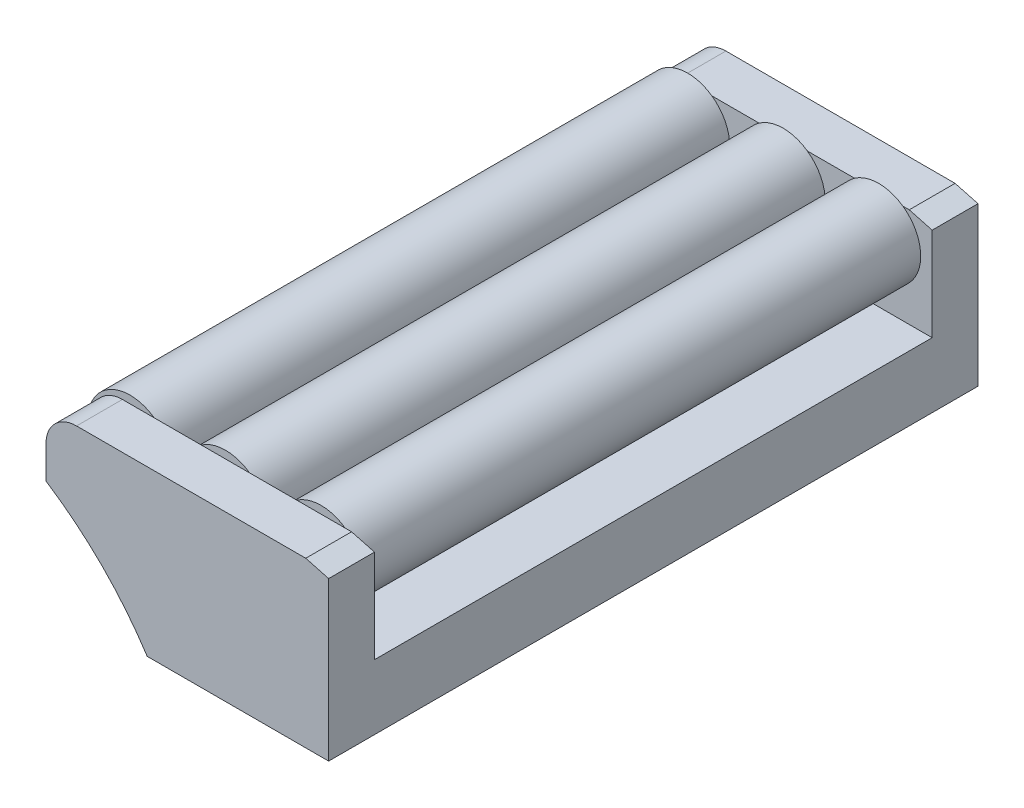
from build123d import *
from OCP.BRepFilletAPI import BRepFilletAPI_MakeChamfer

# Parameters (mm, degrees)
SCHIZZO1_W               = 37
SCHIZZO1_H               = 21.5
ESTRUSIONE1_DEPTH        = 85
SCHIZZO6_W               = 73
SCHIZZO6_H               = 23.639461627
TAGLIO_ESTRUSIONE4_DEPTH = 84
SCHIZZO7_R               = 5.5
ESTRUSIONE4_DEPTH        = 73
SMUSSO1_SIZE             = 3
SMUSSO1_SIZE2            = 0.803847577
RACCORDO1_R              = 4
SCHIZZO8_R               = 45
TAGLIO_ESTRUSIONE5_DEPTH = 96.395230489
SCHIZZO9_R               = 3
TAGLIO_ESTRUSIONE6_DEPTH = 8.5


with BuildPart() as part:
    # Schizzo1 → Estrusione1 (new body)
    with BuildSketch(Plane.XY):
        with Locations((18.5, 10.75)):
            Rectangle(SCHIZZO1_W, SCHIZZO1_H)
    extrude(amount=ESTRUSIONE1_DEPTH)

    # Schizzo6 → Taglio-Estrusione4 (cut)
    with BuildSketch(Plane(origin=(37, 0, 0), x_dir=(0, 0, -1), z_dir=(1, 0, 0))):
        with Locations((-42.5, 20.319730814)):
            Rectangle(SCHIZZO6_W, SCHIZZO6_H)
    extrude(amount=-TAGLIO_ESTRUSIONE4_DEPTH, mode=Mode.SUBTRACT)

    # Schizzo7 → Estrusione4 (add)
    with BuildSketch(Plane.XY.offset(6)):
        with Locations(Location((5, 17, 0), (0, 0, 155.380022671))):
            Circle(SCHIZZO7_R)
        with Locations(Location((17.5, 17, 0), (0, 0, 125.096801228))):
            Circle(SCHIZZO7_R)
        with Locations(Location((30, 17, 0), (0, 0, 125.096801228))):
            Circle(SCHIZZO7_R)
    extrude(amount=ESTRUSIONE4_DEPTH)

    # Smusso1: one chamfer whose edges measure the first distance from different faces: ONE call of the kernel's chamfer builder (chamfer() names one face for all edges)
    smusso1_edges_1 = [part.edges().sort_by_distance(p)[0] for p in [
        (37, 21.5, 3),
    ]]
    smusso1_side_1 = [part.faces().sort_by_distance(p)[0] for p in [
        (18.5, 21.5, 3),
    ]]
    smusso1_edges_2 = [part.edges().sort_by_distance(p)[0] for p in [
        (37, 21.5, 82),
    ]]
    smusso1_side_2 = [part.faces().sort_by_distance(p)[0] for p in [
        (18.5, 21.5, 82),
    ]]
    smusso1 = BRepFilletAPI_MakeChamfer(part.part.solid().wrapped)
    for e in smusso1_edges_1:
        smusso1.Add(SMUSSO1_SIZE, SMUSSO1_SIZE2, e.wrapped, smusso1_side_1[0].wrapped)  # the first distance lies on this face
    for e in smusso1_edges_2:
        smusso1.Add(SMUSSO1_SIZE, SMUSSO1_SIZE2, e.wrapped, smusso1_side_2[0].wrapped)  # the first distance lies on this face
    add(Compound.cast(smusso1.Shape()), mode=Mode.REPLACE)

    # Raccordo1
    # the kernel refuses this fillet: 4 mm, written as the material it takes off along each edge
    with BuildSketch(Plane(origin=(0, 21.5, -10), x_dir=(1, 0, 0), z_dir=(0, 0, 1))) as raccordo1_piece_1:
        with BuildLine():
            CenterArc((RACCORDO1_R, -RACCORDO1_R), RACCORDO1_R, 90, 90)
            Line((0, -RACCORDO1_R), (0, 0))
            Line((0, 0), (RACCORDO1_R, 0))
        make_face()
    extrude(amount=16, mode=Mode.SUBTRACT)
    with BuildSketch(Plane(origin=(0, 21.5, 79), x_dir=(0, -1, 0), z_dir=(0, 0, 1))) as raccordo1_piece_2:
        with BuildLine():
            CenterArc((RACCORDO1_R, RACCORDO1_R), RACCORDO1_R, 180, 90)
            Line((0, RACCORDO1_R), (0, 0))
            Line((0, 0), (RACCORDO1_R, 0))
        make_face()
    extrude(amount=16, mode=Mode.SUBTRACT)

    # Schizzo8 → Taglio-Estrusione5 (cut, through all)
    with BuildSketch(Plane.XY.offset(85)):
        with Locations((-24.5, -24.5)):
            Circle(SCHIZZO8_R)
    extrude(amount=-TAGLIO_ESTRUSIONE5_DEPTH, mode=Mode.SUBTRACT)

    # Schizzo9 → Taglio-Estrusione6 (cut)
    with BuildSketch(Plane.XZ):
        with Locations(Location((23, 75.5, 0), (0, 0, 270))):
            Circle(SCHIZZO9_R)
        with Locations(Location((23, 9.5, 0), (0, 0, 270))):
            Circle(SCHIZZO9_R)
    extrude(amount=-TAGLIO_ESTRUSIONE6_DEPTH, mode=Mode.SUBTRACT)


solid = part.part
